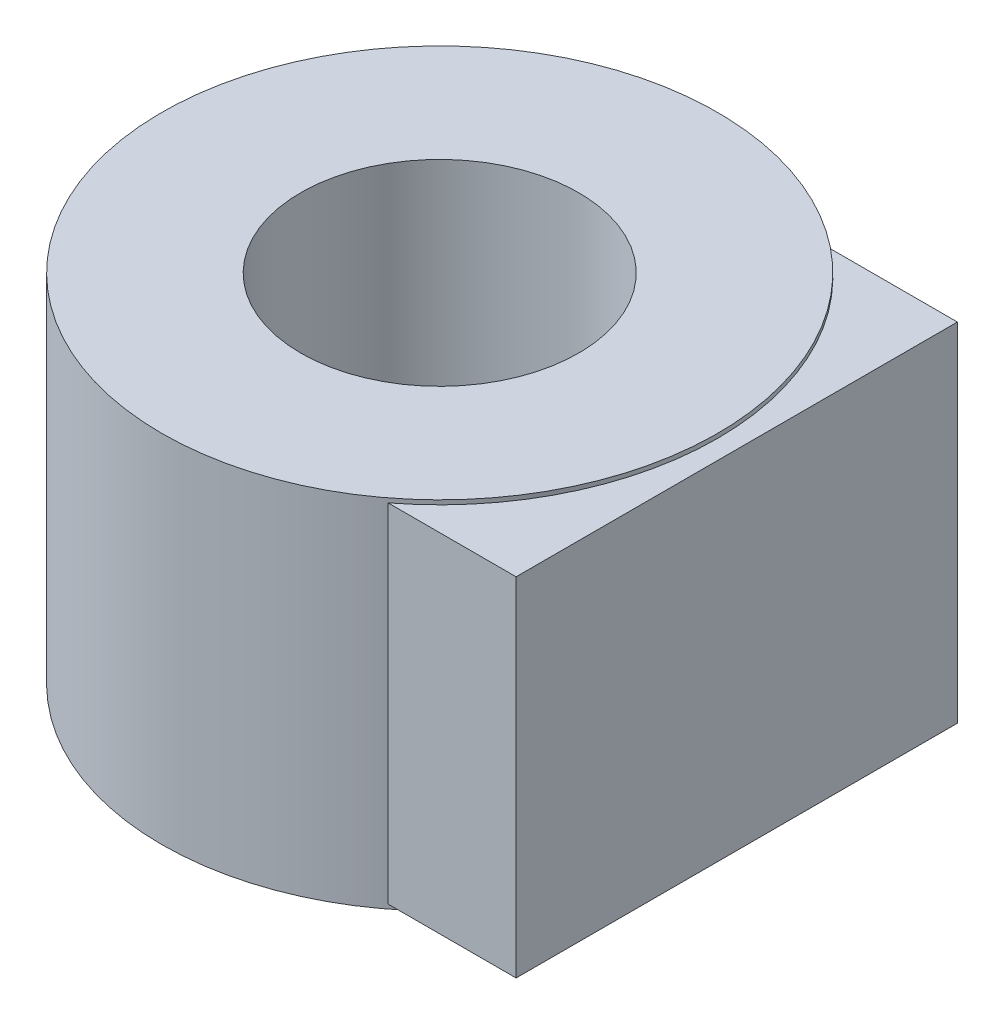
from build123d import *

# Parameters (mm, degrees)
SKETCH1_W           = 36
SKETCH1_H           = 20
BOSS_EXTRUDE1_DEPTH = 12.7
SKETCH2_R           = 16
BOSS_EXTRUDE2_DEPTH = 10.25
SKETCH3_R           = 8
CUT_EXTRUDE1_DEPTH  = 33
SKETCH4_W           = 18.902013076
SKETCH4_H           = 25.4
CUT_EXTRUDE2_DEPTH  = 43.685624044
SCALE1_SCALE        = 0.7
SCALE2_SCALE        = 0.5


with BuildPart() as part:
    # Sketch1 → Boss-Extrude1 (new, symmetric)
    with BuildSketch(Plane.XY):
        Rectangle(SKETCH1_W, SKETCH1_H)
    extrude(amount=BOSS_EXTRUDE1_DEPTH, both=True)

    # Sketch2 → Boss-Extrude2 (add, symmetric)
    with BuildSketch(Plane(origin=(0, 0, 0), x_dir=(1, 0, 0), z_dir=(0, 1, 0))):
        with Locations((-18, 0)):
            Circle(SKETCH2_R)
    extrude(amount=BOSS_EXTRUDE2_DEPTH, both=True)

    # Sketch3 → Cut-Extrude1 (cut)
    with BuildSketch(Plane(origin=(0, 10.25, 0), x_dir=(1, 0, 0), z_dir=(0, 1, 0))):
        with Locations((-18, 0)):
            Circle(SKETCH3_R)
    extrude(amount=-CUT_EXTRUDE1_DEPTH, mode=Mode.SUBTRACT)

    # Sketch4 → Cut-Extrude2 (cut, through all)
    with BuildSketch(Plane(origin=(0, 10, 0), x_dir=(1, 0, 0), z_dir=(0, 1, 0))):
        with Locations((8.548993462, 0)):
            Rectangle(SKETCH4_W, SKETCH4_H)
    extrude(amount=-CUT_EXTRUDE2_DEPTH, mode=Mode.SUBTRACT)


with BuildPart() as part_1:
    # Scale1: scaled about (-16.351636247, 0, 0)
    add(part.part.scale(SCALE1_SCALE).moved(Location((-4.905490874, 0, 0))))


with BuildPart() as part_2:
    # Scale2: scaled about (-16.351636247, 0, 0)
    add(part_1.part.scale(SCALE2_SCALE).moved(Location((-8.175818123, 0, 0))))


solid = part_2.part
